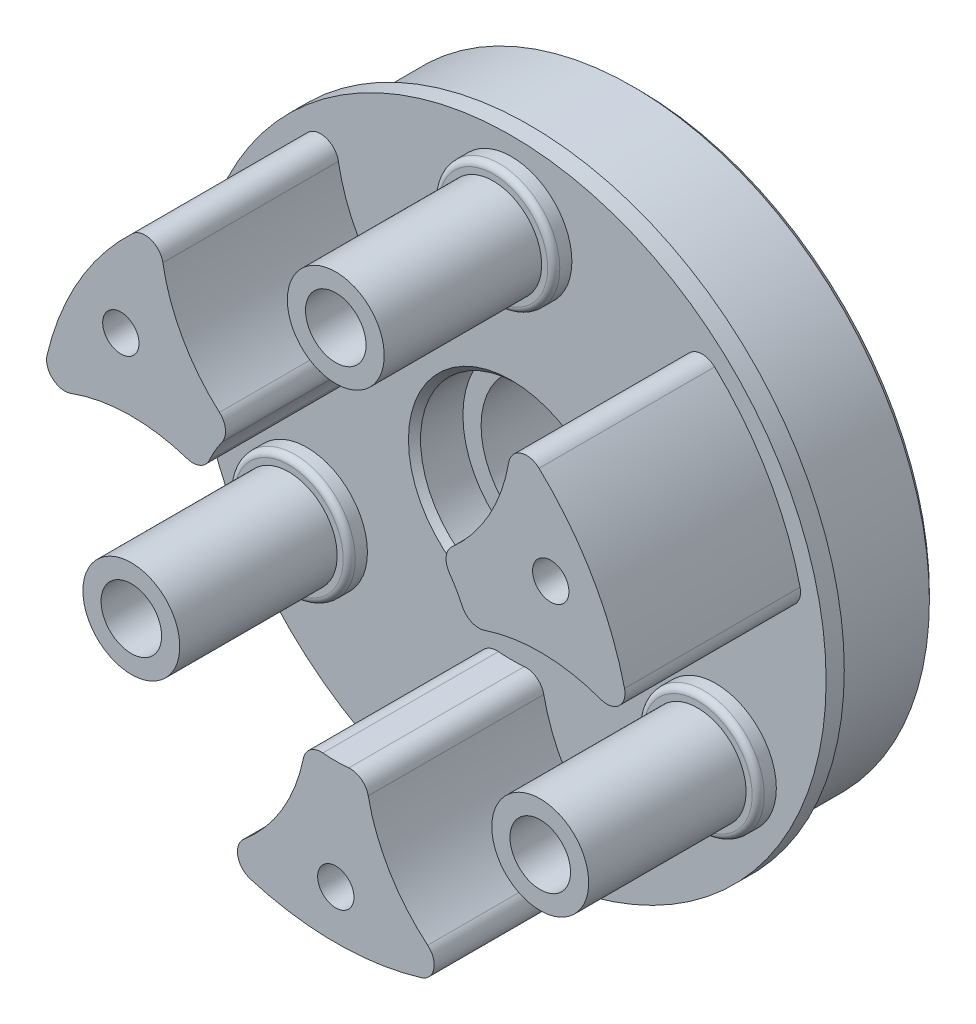
from build123d import *

# Parameters (mm, degrees)
SKETCH1_R           = 24.5
SKETCH1_R_2         = 2.4999999999999996
SKETCH1_R_3         = 2.499999999999988
SKETCH1_R_4         = 2.5000000000000018
BOSS_EXTRUDE1_DEPTH = 10.530000000000001
SKETCH2_R           = 4
SKETCH2_R_2         = 2.4999999999999996
BOSS_EXTRUDE2_DEPTH = 14.5
SKETCH3_R           = 5
SKETCH3_R_2         = 4
BOSS_EXTRUDE3_DEPTH = 1.5
BOSS_EXTRUDE4_DEPTH = 14.5
FILLET2_R           = 0.5
FILLET5_R           = 1.5
CIRPATTERN1_START   = 10.53
CIRPATTERN1_DEPTH   = 14.5
SKETCH5_R           = 1.5000000000000442
CUT_EXTRUDE1_DEPTH  = 43.74343124745603
SKETCH6_R           = 2.7499999999999947
CUT_EXTRUDE2_DEPTH  = 3
SKETCH7_R           = 4.25
CUT_EXTRUDE3_DEPTH  = 5
CIRPATTERN2_COUNT   = 3
CHAMFER1_SIZE       = 0.5
SKETCH9_R           = 8
CUT_EXTRUDE4_DEPTH  = 38.559952245709795
BOSS_EXTRUDE7_START = -6.530000000000001
SKETCH10_R          = 8
SKETCH10_R_2        = 6.500000000000002
BOSS_EXTRUDE7_DEPTH = 6.530000000000001
CHAMFER2_SIZE       = 0.5
BOSS_EXTRUDE8_START = -1.5
SKETCH11_R          = 26.000000000000007
SKETCH11_R_2        = 24.5
BOSS_EXTRUDE8_DEPTH = 1.5


# Read off the part's stored shape, not the designer's step: CirPattern1
with BuildPart() as part:
    # Sketch1 → Boss-Extrude1 (new body)
    with BuildSketch(Plane.XY):
        Circle(SKETCH1_R)
        with Locations((0, 19.5)):
            Circle(SKETCH1_R_2, mode=Mode.SUBTRACT)
        with Locations((16.887495373796185, -9.750000000000636)):
            Circle(SKETCH1_R_3, mode=Mode.SUBTRACT)
        with Locations((-16.887495373797307, -9.750000000000002)):
            Circle(SKETCH1_R_4, mode=Mode.SUBTRACT)
    extrude(amount=BOSS_EXTRUDE1_DEPTH)

    # Sketch2 → Boss-Extrude2 (add)
    with BuildSketch(Plane.XY.offset(10.530000000000001)):
        with Locations(Location((0, 19.5, 0), (0, 0, 180))):
            Circle(SKETCH2_R)
        with Locations((0, 19.5)):
            Circle(SKETCH2_R_2, mode=Mode.SUBTRACT)
    extrude(amount=BOSS_EXTRUDE2_DEPTH)

    # Sketch3 → Boss-Extrude3 (add)
    with BuildSketch(Plane.XY.offset(10.530000000000001)):
        with Locations(Location((0, 19.5, 0), (0, 0, 90))):
            Circle(SKETCH3_R)
        with Locations(Location((0, 19.5, 0), (0, 0, 180))):
            Circle(SKETCH3_R_2, mode=Mode.SUBTRACT)
    extrude(amount=BOSS_EXTRUDE3_DEPTH)

    # Sketch4 → Boss-Extrude4 (add)
    with BuildSketch(Plane.XY.offset(10.530000000000001)):
        with BuildLine():
            ThreePointArc((-8.496322733983213, 7.75), (-12.968536294458422, 13.01408708204353), (-14.497844667397978, 19.750000000000004))
            ThreePointArc((-14.497844667397978, 19.75), (-21.21762239271878, 12.249999999999943), (-24.352924058441666, 2.6805017820872727))
            ThreePointArc((-24.352924058441673, 2.6805017820872727), (-17.754798167341832, 4.724038339879645), (-10.959858246321023, 3.48303132638066))
            ThreePointArc((-10.959858246321025, 3.483031326380663), (-9.959292143521058, 5.749999999999978), (-8.496322733983213, 7.750000000000001))
        make_face()
    extrude(amount=BOSS_EXTRUDE4_DEPTH)

    # Fillet2
    fillet2_edges = [part.edges().sort_by_distance(p)[0] for p in [
        (-9.2e-16, 14.5, 12.030000000000001),
    ]]
    fillet(fillet2_edges, radius=FILLET2_R)

    # Fillet5
    fillet5_edges = [part.edges().sort_by_distance(p)[0] for p in [
        (-14.49784466739798, 19.75, 17.78),
        (-24.35292405844167, 2.6805017820872727, 17.78),
        (-10.959858246321025, 3.4830313263806616, 17.78),
        (-8.496322733983215, 7.75, 17.78),
    ]]
    fillet(fillet5_edges, radius=FILLET5_R)

    # CirPattern1 outline → CirPattern1 (add)
    with BuildSketch(Plane.XY.offset(CIRPATTERN1_START)):
        with BuildLine():
            ThreePointArc((-1.069906346, -11.450122288), (-2.103251355, -11.738985499), (-2.679275225, -12.644214953))
            ThreePointArc((-2.679275225, -12.644214953), (-4.43366395, -17.176444835), (-7.58708663, -20.874405476))
            ThreePointArc((-7.58708663, -20.874405476), (-8.094453803, -22.326259468), (-7.057038992, -23.461632523))
            ThreePointArc((-7.057038992, -23.461632523), (0, -24.5), (7.057038992, -23.461632523))
            ThreePointArc((7.057038992, -23.461632523), (8.094453803, -22.326259468), (7.58708663, -20.874405476))
            ThreePointArc((7.58708663, -20.874405476), (4.43366395, -17.176444835), (2.679275225, -12.644214953))
            ThreePointArc((2.679275225, -12.644214953), (2.103251355, -11.738985499), (1.069906346, -11.450122288))
            ThreePointArc((1.069906346, -11.450122288), (0, -11.5), (-1.069906346, -11.450122288))
        make_face()
        with BuildLine():
            ThreePointArc((23.846889276, 5.619241219), (21.217622393, 12.25), (16.789850284, 17.842391304))
            ThreePointArc((16.789850284, 17.842391304), (15.28788097, 18.173132357), (14.284222116, 17.0078125))
            ThreePointArc((14.284222116, 17.0078125), (12.658405598, 12.42788803), (9.610573748, 8.642427885))
            ThreePointArc((9.610573748, 8.642427885), (9.11463398, 7.690961853), (9.381143605, 6.651627219))
            ThreePointArc((9.381143605, 6.651627219), (9.959292144, 5.75), (10.451049951, 4.798495069))
            ThreePointArc((10.451049951, 4.798495069), (11.217885334, 4.048023646), (12.289848972, 4.001787068))
            ThreePointArc((12.289848972, 4.001787068), (17.092069548, 4.748556804), (21.871308746, 3.866592976))
            ThreePointArc((21.871308746, 3.866592976), (23.382334773, 4.153127111), (23.846889276, 5.619241219))
        make_face()
    extrude(amount=CIRPATTERN1_DEPTH)

    # CirPattern1 2 outline → CirPattern1 2 (revolve)
    with BuildSketch(Plane(origin=(-16.887495374, -9.75, 0), x_dir=(1, 0, 0), z_dir=(0, -1, 0))):
        with BuildLine():
            Line((4, 25.03), (2.5, 25.03))
            Line((2.5, 25.03), (2.5, 10.53))
            Line((2.5, 10.53), (5, 10.53))
            Line((5, 10.53), (5, 11.53))
            ThreePointArc((5, 11.53), (4.853553391, 11.883553391), (4.5, 12.03))
            Line((4.5, 12.03), (4, 12.03))
            Line((4, 12.03), (4, 25.03))
        make_face()
    revolve(axis=Axis((-16.887495374, -9.75, 0), (0, 0, 1)))

    # CirPattern1 3 outline → CirPattern1 3 (revolve)
    with BuildSketch(Plane(origin=(16.887495374, -9.75, 0), x_dir=(1, 0, 0), z_dir=(0, -1, 0))):
        with BuildLine():
            Line((4, 25.03), (2.5, 25.03))
            Line((2.5, 25.03), (2.5, 10.53))
            Line((2.5, 10.53), (5, 10.53))
            Line((5, 10.53), (5, 11.53))
            ThreePointArc((5, 11.53), (4.853553391, 11.883553391), (4.5, 12.03))
            Line((4.5, 12.03), (4, 12.03))
            Line((4, 12.03), (4, 25.03))
        make_face()
    revolve(axis=Axis((16.887495374, -9.75, 0), (0, 0, 1)))

    # Sketch5 → Cut-Extrude1 (cut, through all)
    with BuildSketch(Plane.XY.offset(25.030000000000005)):
        with Locations((-17.753520777581024, 10.249999999999956)):
            Circle(SKETCH5_R)
    cut_extrude1 = extrude(amount=-CUT_EXTRUDE1_DEPTH, mode=Mode.SUBTRACT)

    # Sketch6 → Cut-Extrude2 (cut)
    with BuildSketch(Plane(origin=(0, 0, 0), x_dir=(-1, 0, 0), z_dir=(0, 0, -1))):
        with Locations((17.753520777581024, 10.249999999999956)):
            Circle(SKETCH6_R)
    cut_extrude2 = extrude(amount=-CUT_EXTRUDE2_DEPTH, mode=Mode.SUBTRACT)

    # Sketch7 → Cut-Extrude3 (cut)
    with BuildSketch(Plane(origin=(0, 0, 0), x_dir=(-1, 0, 0), z_dir=(0, 0, -1))):
        with Locations((0, 19.5)):
            Circle(SKETCH7_R)
    cut_extrude3 = extrude(amount=-CUT_EXTRUDE3_DEPTH, mode=Mode.SUBTRACT)

    # CirPattern2: Cut-Extrude1, Cut-Extrude2, Cut-Extrude3 ×3 about axis
    cirpattern2_axis = Axis((1.3e-16, -8.9e-16, 0), (0, 0, 1))
    add([cut_extrude1.rotate(cirpattern2_axis, i * 360 / CIRPATTERN2_COUNT) for i in range(1, CIRPATTERN2_COUNT)], mode=Mode.SUBTRACT)
    add([cut_extrude2.rotate(cirpattern2_axis, i * 360 / CIRPATTERN2_COUNT) for i in range(1, CIRPATTERN2_COUNT)], mode=Mode.SUBTRACT)
    add([cut_extrude3.rotate(cirpattern2_axis, i * 360 / CIRPATTERN2_COUNT) for i in range(1, CIRPATTERN2_COUNT)], mode=Mode.SUBTRACT)

    # Chamfer1
    chamfer1_edges = [part.edges().sort_by_distance(p)[0] for p in [
        (-24.5, 3e-15, 0),
    ]]
    chamfer(chamfer1_edges, length=CHAMFER1_SIZE)

    # Sketch9 → Cut-Extrude4 (cut, through all)
    with BuildSketch(Plane.XY.offset(10.530000000000001)):
        Circle(SKETCH9_R)
    extrude(amount=-CUT_EXTRUDE4_DEPTH, mode=Mode.SUBTRACT)

    # Sketch10 → Boss-Extrude7 (add)
    with BuildSketch(Plane(origin=(0, 0, 0), x_dir=(-1, 0, 0), z_dir=(0, 0, -1)).offset(BOSS_EXTRUDE7_START)):
        with Locations(Location((0, 0, 0), (0, 0, 180))):
            Circle(SKETCH10_R)
        Circle(SKETCH10_R_2, mode=Mode.SUBTRACT)
    extrude(amount=BOSS_EXTRUDE7_DEPTH)

    # Chamfer2
    chamfer2_edges = [part.edges().sort_by_distance(p)[0] for p in [
        (-8, 9.8e-16, 10.530000000000001),
    ]]
    chamfer(chamfer2_edges, length=CHAMFER2_SIZE)

    # Sketch11 → Boss-Extrude8 (add)
    with BuildSketch(Plane.XY.offset(10.530000000000001).offset(BOSS_EXTRUDE8_START)):
        Circle(SKETCH11_R)
        Circle(SKETCH11_R_2, mode=Mode.SUBTRACT)
    extrude(amount=BOSS_EXTRUDE8_DEPTH)


solid = part.part
